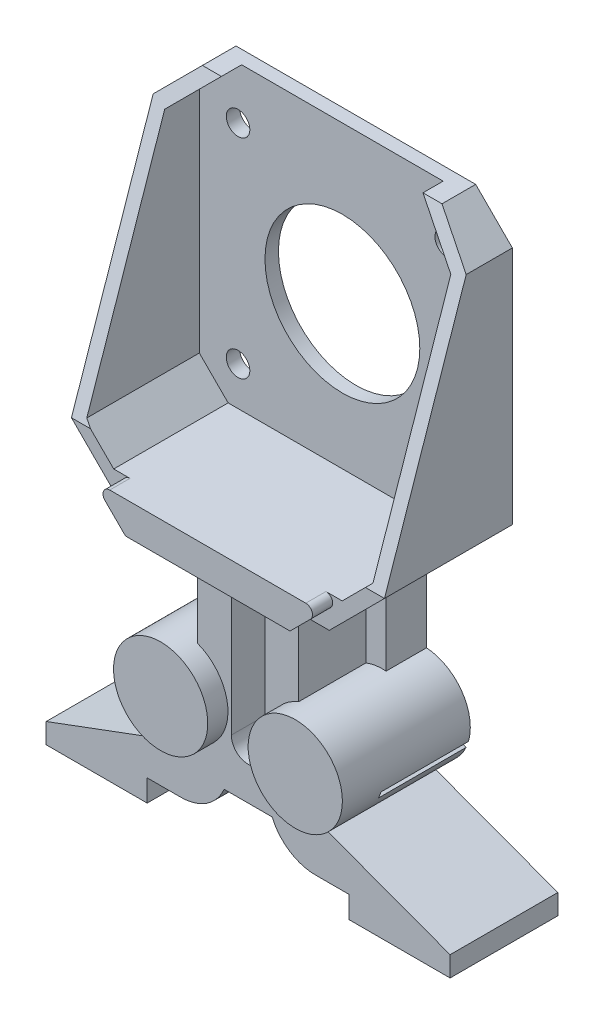
from build123d import *

# Parameters (mm, degrees)
SKETCH3_R               = 11.5
SKETCH3_R_2             = 1.75
BOSS_EXTRUDE1_DEPTH     = 19
CUT_EXTRUDE1_START      = 19
SKETCH3_3_R             = 11.5
SKETCH3_3_R_2           = 1.75
CUT_EXTRUDE1_DEPTH      = 17
SKETCH3_4_R             = 1.75
SKETCH3_4_R_2           = 11.5
CUT_EXTRUDE3_DEPTH      = 38.975320933
CUT_EXTRUDE7_DEPTH      = 38.975320933
CUT_EXTRUDE7_DEPTH_BACK = 38.975320933
CUT_EXTRUDE8_DEPTH      = 38.015199581
BOSS_EXTRUDE4_DEPTH     = 19
BOSS_EXTRUDE5_START     = 19
BOSS_EXTRUDE5_DEPTH     = 3
BOSS_EXTRUDE6_DEPTH     = 6
BOSS_EXTRUDE7_START     = -6
BOSS_EXTRUDE7_DEPTH     = 16
SKETCH14_R              = 7
BOSS_EXTRUDE8_DEPTH     = 3
CUT_EXTRUDE10_DEPTH     = 13


# Read off the part's stored shape, not the designer's step: Boss-Extrude7, Cut-Extrude10
with BuildPart() as part:
    # Sketch3 → Boss-Extrude1 (new body)
    # profile 1 of 7: a face of its own
    with BuildSketch(Plane.XY):
        Polygon((-23.25, 17.798989873), (-17.798989873, 23.25), (17.798989873, 23.25), (23.25, 17.798989873), (23.25, -17.798989873), (17.798989873, -23.25), (-17.798989873, -23.25), (-23.25, -17.798989873), align=None)
        Polygon((21.25, 16.970562748), (16.970562748, 21.25), (-16.970562748, 21.25), (-21.25, 16.970562748), (-21.25, -16.970562748), (-16.970562748, -21.25), (16.970562748, -21.25), (21.25, -16.970562748), align=None, mode=Mode.SUBTRACT)
    # profile 2 of 7: a face of its own
    with BuildSketch(Plane.XY):
        Polygon((21.25, 16.970562748), (21.25, -16.970562748), (16.970562748, -21.25), (-16.970562748, -21.25), (-21.25, -16.970562748), (-21.25, 16.970562748), (-16.970562748, 21.25), (16.970562748, 21.25), align=None)
        Circle(SKETCH3_R, mode=Mode.SUBTRACT)
        with Locations((-15.5, -15.5)):
            Circle(SKETCH3_R_2, mode=Mode.SUBTRACT)
        with Locations((15.5, -15.5)):
            Circle(SKETCH3_R_2, mode=Mode.SUBTRACT)
        with Locations((15.5, 15.5)):
            Circle(SKETCH3_R_2, mode=Mode.SUBTRACT)
        with Locations((-15.5, 15.5)):
            Circle(SKETCH3_R_2, mode=Mode.SUBTRACT)
    # profile 3 of 7: a face of its own
    with BuildSketch(Plane.XY):
        with Locations((-15.5, 15.5)):
            Circle(SKETCH3_R_2)
    # profile 4 of 7: a face of its own
    with BuildSketch(Plane.XY):
        with Locations((15.5, 15.5)):
            Circle(SKETCH3_R_2)
    # profile 5 of 7: a face of its own
    with BuildSketch(Plane.XY):
        with Locations((15.5, -15.5)):
            Circle(SKETCH3_R_2)
    # profile 6 of 7: a face of its own
    with BuildSketch(Plane.XY):
        with Locations((-15.5, -15.5)):
            Circle(SKETCH3_R_2)
    # profile 7 of 7: a face of its own
    with BuildSketch(Plane.XY):
        Circle(SKETCH3_R)
    extrude(amount=BOSS_EXTRUDE1_DEPTH)

    # Sketch3<3> → Cut-Extrude1 (cut)
    with BuildSketch(Plane.XY.offset(CUT_EXTRUDE1_START)):
        Polygon((21.25, 16.970562748), (21.25, -16.970562748), (16.970562748, -21.25), (-16.970562748, -21.25), (-21.25, -16.970562748), (-21.25, 16.970562748), (-16.970562748, 21.25), (16.970562748, 21.25), align=None)
        Circle(SKETCH3_3_R, mode=Mode.SUBTRACT)
        with Locations((-15.5, -15.5)):
            Circle(SKETCH3_3_R_2, mode=Mode.SUBTRACT)
        with Locations((15.5, -15.5)):
            Circle(SKETCH3_3_R_2, mode=Mode.SUBTRACT)
        with Locations((15.5, 15.5)):
            Circle(SKETCH3_3_R_2, mode=Mode.SUBTRACT)
        with Locations((-15.5, 15.5)):
            Circle(SKETCH3_3_R_2, mode=Mode.SUBTRACT)
    extrude(amount=-CUT_EXTRUDE1_DEPTH, mode=Mode.SUBTRACT)

    # Sketch3<4> → Cut-Extrude3 (cut, through all)
    with BuildSketch(Plane.XY):
        with Locations(Location((-15.5, 15.5, 0), (0, 0, 180))):
            Circle(SKETCH3_4_R)
        with Locations(Location((15.5, 15.5, 0), (0, 0, 180))):
            Circle(SKETCH3_4_R)
        with Locations(Location((-15.5, -15.5, 0), (0, 0, 180))):
            Circle(SKETCH3_4_R)
        with Locations(Location((0, 0, 0), (0, 0, 180))):
            Circle(SKETCH3_4_R_2)
        with Locations(Location((15.5, -15.5, 0), (0, 0, 180))):
            Circle(SKETCH3_4_R)
    extrude(amount=CUT_EXTRUDE3_DEPTH, mode=Mode.SUBTRACT)

    # Sketch6 → Cut-Extrude7 (cut, two sides: drawn at the far end of the back side and taken through both)
    with BuildSketch(Plane(origin=(0, 0, 0), x_dir=(0, 0, -1), z_dir=(1, 0, 0)).offset(-CUT_EXTRUDE7_DEPTH_BACK)):
        Polygon((-19, 23.25), (-5, 23.25), (-19, -17.798989873), align=None)
    extrude(amount=CUT_EXTRUDE7_DEPTH + CUT_EXTRUDE7_DEPTH_BACK, mode=Mode.SUBTRACT)

    # Sketch8 → Cut-Extrude8 (cut, through all)
    with BuildSketch(Plane.XY.offset(2)):
        Polygon((-16.970562748, 21.25), (-14.970562748, 23.25), (14.970562748, 23.25), (16.970562748, 21.25), align=None)
    extrude(amount=CUT_EXTRUDE8_DEPTH, mode=Mode.SUBTRACT)

    # Sketch10 → Boss-Extrude4 (add)
    with BuildSketch(Plane.XY):
        Polygon((19.798989873, -21.25), (-19.798989873, -21.25), (-15.048989873, -26), (15.048989873, -26), align=None)
    extrude(amount=BOSS_EXTRUDE4_DEPTH)

    # Sketch11 → Boss-Extrude5 (add)
    with BuildSketch(Plane.XY.offset(BOSS_EXTRUDE5_START)):
        with BuildLine():
            Line((-14.556349186, -21.25), (14.556349186, -21.25))
            ThreePointArc((14.556349186, -21.25), (15.480228719, -21.867316568), (15.263455967, -22.957106781))
            Line((15.263455967, -22.957106781), (12.220562748, -26))
            Line((12.220562748, -26), (-12.220562748, -26))
            Line((-12.220562748, -26), (-15.263455967, -22.957106781))
            ThreePointArc((-15.263455967, -22.957106781), (-15.480228719, -21.867316568), (-14.556349186, -21.25))
        make_face()
    extrude(amount=BOSS_EXTRUDE5_DEPTH)


with BuildPart() as body_2:
    # Sketch12 → Boss-Extrude6 (new body)
    with BuildSketch(Plane.XY):
        with BuildLine():
            Line((2.5, -28.5), (2.5, -49.75))
            ThreePointArc((2.5, -49.75), (1.767766953, -51.517766953), (0, -52.25))
            Line((0, -52.25), (0, -57.25))
            Line((0, -57.25), (10.5, -57.25))
            Line((10.5, -57.25), (10.5, -30.548989873))
            Line((10.5, -30.548989873), (15.048989873, -26))
            Line((15.048989873, -26), (0, -26))
            ThreePointArc((0, -26), (1.767766953, -26.732233047), (2.5, -28.5))
        make_face()
    extrude(amount=BOSS_EXTRUDE6_DEPTH)

    # Boss-Extrude7 outline → Boss-Extrude7 (add)
    with BuildSketch(Plane.XY.offset(6).offset(BOSS_EXTRUDE7_START)):
        with BuildLine():
            Line((30, -61.75), (10.5, -54.5))
            Line((10.5, -54.5), (10.5, -53.982120022))
            ThreePointArc((10.5, -53.982120022), (16.833795921, -45.483677703), (7.5, -40.461651585))
            Line((7.5, -40.461651585), (7.5, -26))
            Line((7.5, -26), (0, -26))
            ThreePointArc((0, -26), (1.767766953, -26.732233047), (2.5, -28.5))
            Line((2.5, -28.5), (2.5, -49.75))
            ThreePointArc((2.5, -49.75), (1.767766953, -51.517766953), (0, -52.25))
            Line((0, -52.25), (0, -57.25))
            Line((0, -57.25), (3.562803405, -57.25))
            ThreePointArc((3.562803405, -57.25), (6.143187845, -60.341660723), (10, -61.5))
            Line((10, -61.5), (15, -61.5))
            Line((15, -61.5), (15, -64.75))
            Line((15, -64.75), (30, -64.75))
            Line((30, -64.75), (30, -61.75))
        make_face()
    extrude(amount=BOSS_EXTRUDE7_DEPTH)

    # Sketch14 → Boss-Extrude8 (add)
    with BuildSketch(Plane.XY.offset(16)):
        with Locations((10, -47)):
            Circle(SKETCH14_R)
    extrude(amount=BOSS_EXTRUDE8_DEPTH)

    # Cut-Extrude10 outline → Cut-Extrude10 (cut)
    with BuildSketch(Plane.XY):
        with BuildLine():
            ThreePointArc((12.946853826, -47.562185494), (7.188060526, -45.95453532), (12.5983656, -48.499498652))
            Line((12.5983656, -48.499498652), (16.370188856, -49.901843196))
            ThreePointArc((16.370188856, -49.901843196), (16.561192108, -49.439417579), (16.718677082, -48.964530038))
            Line((16.718677082, -48.964530038), (12.946853826, -47.562185494))
        make_face()
    extrude(amount=CUT_EXTRUDE10_DEPTH, mode=Mode.SUBTRACT)


with BuildPart() as body_3:
    # Mirror1: mirrored copy
    add(body_2.part.mirror(Plane(origin=(0, 0, 0), x_dir=(0, 0, 1), z_dir=(1, 0, 0))))


with BuildPart() as body_2_1:
    add(body_2.part)

    # Combine1: union body 3, part
    add(body_3.part)
    add(part.part)


solid = body_2_1.part
